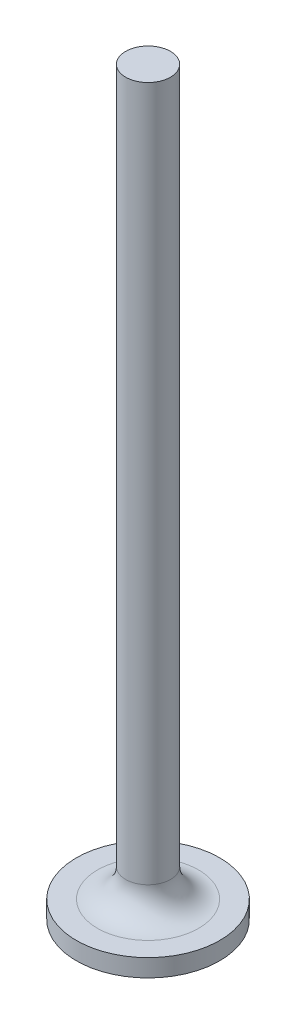
from build123d import *

# Parameters (mm, degrees)
FILLET1_R = 4


with BuildPart() as part:
    # Sketch1 → Revolve1 (revolve)
    with BuildSketch(Plane.XY):
        Polygon((0, 0), (10.16, 0), (10.16, 2.5), (3.175, 2.5), (3.175, 105), (0, 105), align=None)
    revolve(axis=Axis((0, -31.831703756, 0), (0, 1, 0)))

    # Fillet1
    fillet1_edges = [part.edges().sort_by_distance(p)[0] for p in [
        (-3.175, 2.5, 0),
    ]]
    fillet(fillet1_edges, radius=FILLET1_R)


solid = part.part
